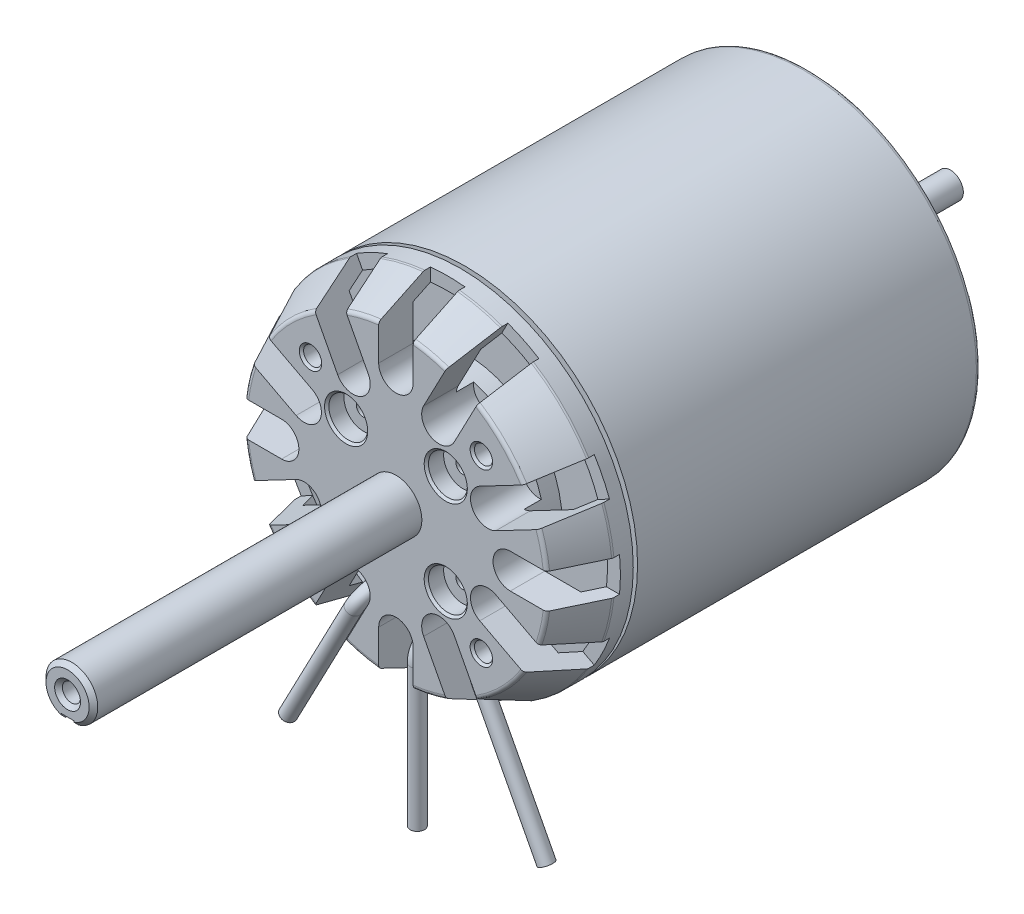
from build123d import *

# Parameters (mm, degrees)
SKETCH1_R                   = 12.5
FILLET1_R                   = 1
CUT_EXTRUDE1_DEPTH          = 12
CIRPATTERN1_COUNT           = 4
SKETCH3_R                   = 17.775588002
CUT_EXTRUDE2_DEPTH          = 12
CIRPATTERN2_COUNT           = 4
M5_TAPPED_HOLE1_D           = 4.2
M5_TAPPED_HOLE1_DEPTH       = 12.4
M5_TAPPED_HOLE1_TIP         = 1.2618073
SKETCH6_W                   = 1.65
SKETCH6_H                   = 40
M4_TAPPED_HOLE2_D           = 3.3
M5_TAPPED_HOLE2_D           = 4.2
M5_TAPPED_HOLE2_DEPTH       = 8
M4_TAPPED_HOLE3_D           = 3.3
M4_TAPPED_HOLE3_DEPTH       = 21.5
M4_TAPPED_HOLE3_TIP         = 0.991420021
SKETCH15_R                  = 4.5
CUT_EXTRUDE3_DEPTH          = 4
CHAMFER1_SIZE               = 0.5
SKETCH17_R                  = 1.65
SKETCH18_R                  = 6
BOSS_EXTRUDE1_DEPTH         = 76.1
CUT_EXTRUDE4_REACH          = 138.919
CUT_EXTRUDE4_END_RADIUS     = 6
CUT_EXTRUDE4_START          = -4.5
M5_TAPPED_HOLE3_D           = 4.2
M5_TAPPED_HOLE3_DEPTH       = 24
M5_TAPPED_HOLE3_CSINK_D     = 6
M5_TAPPED_HOLE3_CSINK_ANGLE = 90
M5_TAPPED_HOLE3_TIP         = 1.2618073
BOSS_EXTRUDE2_START         = 35.2
SKETCH22_R                  = 6
BOSS_EXTRUDE2_DEPTH         = 35.2
CHAMFER2_SIZE               = 1
M5_TAPPED_HOLE4_D           = 4.2
M5_TAPPED_HOLE4_DEPTH       = 24
M5_TAPPED_HOLE4_CSINK_D     = 6
M5_TAPPED_HOLE4_CSINK_ANGLE = 90
M5_TAPPED_HOLE4_TIP         = 1.2618073
SKETCH25_W                  = 3
SKETCH25_H                  = 3
CUT_EXTRUDE5_DEPTH          = 70
FILLET2_R                   = 1.5
CUT_EXTRUDE6_START          = 21.4
SKETCH26_R                  = 10.431019844
CUT_EXTRUDE6_DEPTH          = 178.664507082
SKETCH27_OUTSIDE_W          = 130.856
SKETCH27_OUTSIDE_H          = 157.672
SKETCH27_OUTSIDE_R          = 3
CUT_EXTRUDE7_DEPTH          = 12


with BuildPart() as part:
    # Sketch1 → Revolve1 (revolve)
    with BuildSketch(Plane(origin=(0, 0, 0), x_dir=(0, 0, -1), z_dir=(1, 0, 0)), mode=Mode.PRIVATE) as revolve1_sk:
        Polygon((0, 0), (0, 35), (10.5, 40), (15, 40), (15, 37), (12, 37), (8, 35.095238095), (8, 22.5), (15, 22.5), (16, 22.5), (16, 40), (95.1, 40), (107.1, 20), (107.1, 0), align=None)
        with Locations((49.040393393, 20)):
            Circle(SKETCH1_R, mode=Mode.SUBTRACT)
        with BuildLine():
            Line((92.269048105, 35), (91.1, 35))
            Line((91.1, 35), (91.1, 10))
            ThreePointArc((91.1, 10), (95.937489456, 12.583391961), (99.397863491, 16.837922463))
            ThreePointArc((99.397863491, 16.837922463), (96.590681373, 26.216180606), (92.269048105, 35))
        make_face(mode=Mode.SUBTRACT)
    revolve(revolve1_sk.sketch.rotate(Axis((0, 0, 38.636074766), (0, 0, -1)), 90), axis=Axis((0, 0, 38.636074766), (0, 0, -1)))

    # Fillet1
    fillet1_edges = [part.edges().sort_by_distance(p)[0] for p in [
        (-20, 0, -107.1),
        (-40, 0, -95.1),
        (-40, 0, -10.5),
        (-35, 0, 0),
    ]]
    fillet(fillet1_edges, radius=FILLET1_R)

    # Sketch2 → Cut-Extrude1 (cut)
    with BuildSketch(Plane.XY):
        with BuildLine():
            Line((4, 43.5), (4, 26.5))
            ThreePointArc((4, 26.5), (0, 22.5), (-4, 26.5))
            Line((-4, 26.5), (-4, 43.5))
            ThreePointArc((-4, 43.5), (0, 47.5), (4, 43.5))
        make_face()
        with BuildLine():
            Line((-17.110156168, 43.528296815), (-6.421479662, 23.134424425))
            ThreePointArc((-6.421479662, 23.134424425), (-8.10749571, 17.734669811), (-13.507250323, 19.420685859))
            Line((-13.507250323, 19.420685859), (-24.19592683, 39.814558249))
            ThreePointArc((-24.19592683, 39.814558249), (-22.509910782, 45.214312863), (-17.110156168, 43.528296815))
        make_face()
        with BuildLine():
            Line((24.19592683, 39.814558249), (13.507250323, 19.420685859))
            ThreePointArc((13.507250323, 19.420685859), (8.10749571, 17.734669811), (6.421479662, 23.134424425))
            Line((6.421479662, 23.134424425), (17.110156168, 43.528296815))
            ThreePointArc((17.110156168, 43.528296815), (22.509910782, 45.214312863), (24.19592683, 39.814558249))
        make_face()
    cut_extrude1 = extrude(amount=-CUT_EXTRUDE1_DEPTH, mode=Mode.SUBTRACT)

    # CirPattern1: Cut-Extrude1 ×4 about axis
    cirpattern1_axis = Axis((0, 0, 0), (0, 0, 1))
    for i in range(1, CIRPATTERN1_COUNT):
        add(cut_extrude1.rotate(cirpattern1_axis, i * 360 / CIRPATTERN1_COUNT), mode=Mode.SUBTRACT)

    # Sketch3 → Cut-Extrude2 (cut)
    with BuildSketch(Plane(origin=(0, 0, -107.1), x_dir=(-1, 0, 0), z_dir=(0, 0, -1))):
        with Locations((28.125588002, 28.125588002)):
            Circle(SKETCH3_R)
        with BuildLine():
            Line((5, 44.130872228), (5, 25.23751179))
            ThreePointArc((5, 25.23751179), (0, 20.23751179), (-5, 25.23751179))
            Line((-5, 25.23751179), (-5, 44.130872228))
            ThreePointArc((-5, 44.130872228), (0, 49.130872228), (5, 44.130872228))
        make_face()
    cut_extrude2 = extrude(amount=-CUT_EXTRUDE2_DEPTH, mode=Mode.SUBTRACT)

    # CirPattern2: Cut-Extrude2 ×4 about axis
    cirpattern2_axis = Axis((0, 0, 0), (0, 0, 1))
    for i in range(1, CIRPATTERN2_COUNT):
        add(cut_extrude2.rotate(cirpattern2_axis, i * 360 / CIRPATTERN2_COUNT), mode=Mode.SUBTRACT)

    # M5 Tapped Hole1
    with Locations(Plane(origin=(0, 0, -107.1), x_dir=(-1, 0, 0), z_dir=(0, 0, -1))):
        with Locations((-9.25, 9.25), (9.25, 9.25), (9.25, -9.25), (-9.25, -9.25)):
            Hole(M5_TAPPED_HOLE1_D / 2, depth=M5_TAPPED_HOLE1_DEPTH)
            with Locations((0, 0, -(M5_TAPPED_HOLE1_DEPTH + M5_TAPPED_HOLE1_TIP / 2))):  # 118° drill point
                Cone(0, M5_TAPPED_HOLE1_D / 2, M5_TAPPED_HOLE1_TIP, mode=Mode.SUBTRACT)

    # Sketch6 → M4 Tapped Hole1 (revolve, cut)
    with BuildSketch(Plane(origin=(0, 0, -102.766495656), x_dir=(0, 0, 1), z_dir=(0, 1, 0))):
        with Locations((0.825, 20)):
            Rectangle(SKETCH6_W, SKETCH6_H)
    revolve(axis=Axis((-6.35, 0, -102.766495656), (1, 0, 0)), mode=Mode.SUBTRACT)

    # M4 Tapped Hole2 (through all)
    with Locations(Plane(origin=(0, 0, 0), x_dir=(0, 0, -1), z_dir=(1, 0, 0))):
        with Locations((102.766495656, 0)):
            Hole(M4_TAPPED_HOLE2_D / 2)

    # M5 Tapped Hole2
    with Locations(Plane.XY):
        with Locations((-19.798989873, -19.798989873), (19.798989873, -19.798989873), (19.798989873, 19.798989873), (-19.798989873, 19.798989873)):
            Hole(M5_TAPPED_HOLE2_D / 2, depth=M5_TAPPED_HOLE2_DEPTH)

    # M4 Tapped Hole3
    with Locations(Plane.XY):
        with Locations((-11.543518203, 11.543518203), (11.543518203, 11.543518203), (11.543518203, -11.543518203), (-11.543518203, -11.543518203)):
            Hole(M4_TAPPED_HOLE3_D / 2, depth=M4_TAPPED_HOLE3_DEPTH)
            with Locations((0, 0, -(M4_TAPPED_HOLE3_DEPTH + M4_TAPPED_HOLE3_TIP / 2))):  # 118° drill point
                Cone(0, M4_TAPPED_HOLE3_D / 2, M4_TAPPED_HOLE3_TIP, mode=Mode.SUBTRACT)

    # Sketch15 → Cut-Extrude3 (cut)
    with BuildSketch(Plane.XY):
        with Locations((-11.543518203, -11.543518203)):
            Circle(SKETCH15_R)
        with Locations((11.543518203, -11.543518203)):
            Circle(SKETCH15_R)
        with Locations((11.543518203, 11.543518203)):
            Circle(SKETCH15_R)
        with Locations((-11.543518203, 11.543518203)):
            Circle(SKETCH15_R)
    extrude(amount=-CUT_EXTRUDE3_DEPTH, mode=Mode.SUBTRACT)

    # Chamfer1
    chamfer1_edges = [part.edges().sort_by_distance(p)[0] for p in [
        (-17.698989873, 19.798989873, 0),
        (21.898989873, 19.798989873, 0),
        (21.898989873, -19.798989873, 0),
        (-17.698989873, -19.798989873, 0),
        (-16.043518203, -11.543518203, 0),
        (7.043518203, -11.543518203, 0),
        (7.043518203, 11.543518203, 0),
        (-16.043518203, 11.543518203, 0),
    ]]
    chamfer(chamfer1_edges, length=CHAMFER1_SIZE)

    # Sweep1: sweep along a path in Sketch16
    with BuildLine(Plane(origin=(0, 0, 0), x_dir=(0, 0, -1), z_dir=(1, 0, 0))) as sweep1_path:
        Line((4.956666277, -66.816449859), (4.956666277, -34.106380675))
        ThreePointArc((4.956666277, -34.106380675), (6.421132371, -30.570846769), (9.956666277, -29.106380675))
        Line((9.956666277, -29.106380675), (16, -29.106380675))
    # Sketch17 → Sweep1 (sweep)
    with BuildSketch(Plane.XY.offset(-16)):
        with Locations((0, -29.106380675)):
            Circle(SKETCH17_R)
    sweep1 = sweep(path=sweep1_path.line)

    # Mirror1: Sweep1 across plane
    add(sweep1.mirror(Plane(origin=(0.525879499, -0.12945835, 0), x_dir=(0, 0, 1), z_dir=(0.9710101267941458, -0.23903835186684408, 0))))

    # Mirror2: Sweep1 across plane
    add(sweep1.mirror(Plane(origin=(-0.525879499, -0.12945835, 0), x_dir=(0, 0, 1), z_dir=(0.9710101267941456, 0.23903835186684433, 0))))

    # Sketch18 → Boss-Extrude1 (add)
    with BuildSketch(Plane.XY):
        with Locations(Location((0, 0, 0), (0, 0, 180))):
            Circle(SKETCH18_R)
    extrude(amount=BOSS_EXTRUDE1_DEPTH)

    # Cut-Extrude4: up to this cylinder (the profile starts inside it)
    cut_extrude4_end = Plane(origin=(0, 0, 61.5), z_dir=(0, 0, -1)) * Cylinder(CUT_EXTRUDE4_END_RADIUS, 290.838, mode=Mode.PRIVATE)
    # Sketch19 → Cut-Extrude4 (cut, up to the surface)
    with BuildSketch(Plane(origin=(0, 0, 0), x_dir=(1, 0, 0), z_dir=(0, 1, 0)).offset(CUT_EXTRUDE4_START), mode=Mode.PRIVATE) as cut_extrude4_sk1:
        with BuildLine():
            Line((-1.5, -67.5), (-1.5, -55.5))
            ThreePointArc((-1.5, -55.5), (0, -54), (1.5, -55.5))
            Line((1.5, -55.5), (1.5, -67.5))
            ThreePointArc((1.5, -67.5), (0, -69), (-1.5, -67.5))
        make_face()
    cut_extrude4_tool1 = extrude(cut_extrude4_sk1.sketch, amount=-CUT_EXTRUDE4_REACH, mode=Mode.PRIVATE) & cut_extrude4_end
    add(cut_extrude4_tool1.solids().sort_by_distance((0, -4.5, 61.5))[0], mode=Mode.SUBTRACT)

    # M5 Tapped Hole3
    with Locations(Plane.XY.offset(76.1)):
        with Locations((0, 0)):
            CounterSinkHole(M5_TAPPED_HOLE3_D / 2, M5_TAPPED_HOLE3_CSINK_D / 2, depth=M5_TAPPED_HOLE3_DEPTH, counter_sink_angle=M5_TAPPED_HOLE3_CSINK_ANGLE)
            with Locations((0, 0, -(M5_TAPPED_HOLE3_DEPTH + M5_TAPPED_HOLE3_TIP / 2))):  # 118° drill point
                Cone(0, M5_TAPPED_HOLE3_D / 2, M5_TAPPED_HOLE3_TIP, mode=Mode.SUBTRACT)

    # Sketch22 → Boss-Extrude2 (add)
    with BuildSketch(Plane(origin=(0, 0, -107.1), x_dir=(-1, 0, 0), z_dir=(0, 0, -1)).offset(BOSS_EXTRUDE2_START)):
        Circle(SKETCH22_R)
    extrude(amount=-BOSS_EXTRUDE2_DEPTH)

    # Chamfer2
    chamfer2_edges = [part.edges().sort_by_distance(p)[0] for p in [
        (6, 0, 76.1),
    ]]
    chamfer(chamfer2_edges, length=CHAMFER2_SIZE)

    # M5 Tapped Hole4
    with Locations(Plane(origin=(0, 0, -142.3), x_dir=(-1, 0, 0), z_dir=(0, 0, -1))):
        with Locations((0, 0)):
            CounterSinkHole(M5_TAPPED_HOLE4_D / 2, M5_TAPPED_HOLE4_CSINK_D / 2, depth=M5_TAPPED_HOLE4_DEPTH, counter_sink_angle=M5_TAPPED_HOLE4_CSINK_ANGLE)
            with Locations((0, 0, -(M5_TAPPED_HOLE4_DEPTH + M5_TAPPED_HOLE4_TIP / 2))):  # 118° drill point
                Cone(0, M5_TAPPED_HOLE4_D / 2, M5_TAPPED_HOLE4_TIP, mode=Mode.SUBTRACT)

    # Sketch25 → Cut-Extrude5 (cut)
    with BuildSketch(Plane.XY.offset(76.1)):
        with Locations((0, -6)):
            Rectangle(SKETCH25_W, SKETCH25_H)
    extrude(amount=-CUT_EXTRUDE5_DEPTH, mode=Mode.SUBTRACT)

    # Fillet2
    fillet2_edges = [part.edges().sort_by_distance(p)[0] for p in [
        (1.5, -5.15473751, 6.1),
        (-1.5, -5.15473751, 6.1),
    ]]
    fillet(fillet2_edges, radius=FILLET2_R - 0.0001)  # a hair under: the kernel refuses the full size

    # Sketch26 → Cut-Extrude6 (cut, through all)
    with BuildSketch(Plane(origin=(0, 0, -107.1), x_dir=(-1, 0, 0), z_dir=(0, 0, -1)).offset(CUT_EXTRUDE6_START)):
        Circle(SKETCH26_R)
    extrude(amount=CUT_EXTRUDE6_DEPTH, mode=Mode.SUBTRACT)

    # Sketch27 outside → Cut-Extrude7 (cut)
    with BuildSketch(Plane(origin=(0, 0, -128.5), x_dir=(-1, 0, 0), z_dir=(0, 0, -1))):
        with Locations((0, -13.408)):
            Rectangle(SKETCH27_OUTSIDE_W, SKETCH27_OUTSIDE_H)
        Circle(SKETCH27_OUTSIDE_R, mode=Mode.SUBTRACT)
    extrude(amount=-CUT_EXTRUDE7_DEPTH, mode=Mode.SUBTRACT)


solid = part.part
